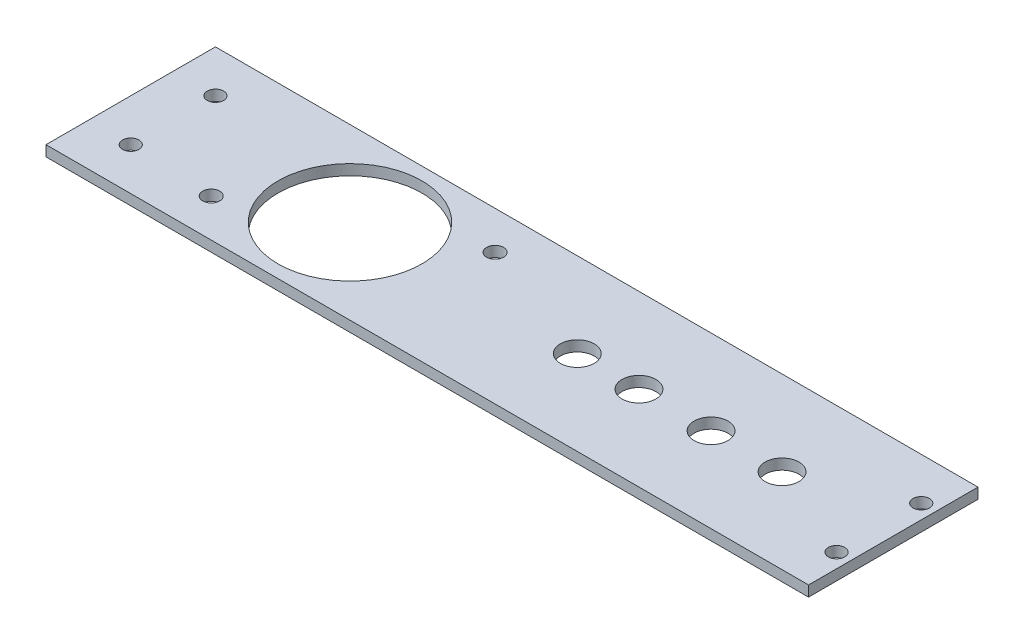
from build123d import *

# Parameters (mm, degrees)
SKETCH1_W                    = 228.6
SKETCH1_H                    = 50.8
BOSS_EXTRUDE1_DEPTH          = 3.175
F_10_0_1935_DIAMETER_HOLE1_D = 4.9149
F_1_4_20_TAPPED_HOLE1_D      = 5.1054
SKETCH6_R                    = 21.573352188
SKETCH6_R_2                  = 5.08
CUT_EXTRUDE1_DEPTH           = 118.131253835


with BuildPart() as part:
    # Sketch1 → Boss-Extrude1 (new body)
    with BuildSketch(Plane(origin=(0, 0, 0), x_dir=(1, 0, 0), z_dir=(0, 1, 0))):
        Rectangle(SKETCH1_W, SKETCH1_H)
    extrude(amount=BOSS_EXTRUDE1_DEPTH)

    # #10 (0.1935) Diameter Hole1 (through all)
    with Locations(Plane(origin=(0, 3.175, 0), x_dir=(1, 0, 0), z_dir=(0, 1, 0))):
        with Locations((109.982, 12.7), (-101.6, -12.7), (-101.6, 12.7), (109.982, -12.7)):
            Hole(F_10_0_1935_DIAMETER_HOLE1_D / 2)

    # 1/4-20 Tapped Hole1 (through all)
    with Locations(Plane(origin=(0, 3.175, 0), x_dir=(1, 0, 0), z_dir=(0, 1, 0))):
        with Locations((-76.2, -13.97), (-19.05, 13.97)):
            Hole(F_1_4_20_TAPPED_HOLE1_D / 2)

    # Sketch6 → Cut-Extrude1 (cut, through all)
    with BuildSketch(Plane(origin=(0, 3.175, 0), x_dir=(1, 0, 0), z_dir=(0, 1, 0))):
        with Locations((-48.569362205, 0)):
            Circle(SKETCH6_R)
        with Locations((80.956112882, 0)):
            Circle(SKETCH6_R_2)
        with Locations((59.671034811, 0)):
            Circle(SKETCH6_R_2)
        with Locations((38.055955528, 0)):
            Circle(SKETCH6_R_2)
        with Locations((19.575887745, 0)):
            Circle(SKETCH6_R_2)
    extrude(amount=-CUT_EXTRUDE1_DEPTH, mode=Mode.SUBTRACT)


solid = part.part
